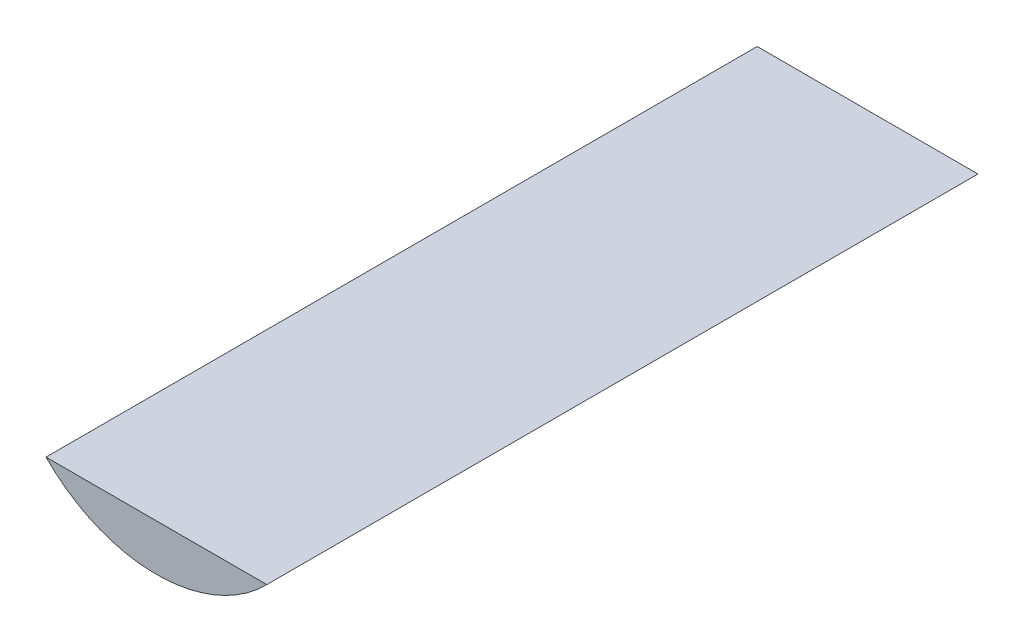
from build123d import *

# Parameters (mm, degrees)
BOSS_EXTRUDE1_DEPTH = 230


with BuildPart() as part:
    # Sketch1 → Boss-Extrude1 (new body)
    with BuildSketch(Plane.XY):
        with BuildLine():
            Line((-35.707142143, -35), (35.707142143, -35))
            ThreePointArc((35.707142143, -35), (0, -50), (-35.707142143, -35))
        make_face()
    extrude(amount=BOSS_EXTRUDE1_DEPTH)


solid = part.part
